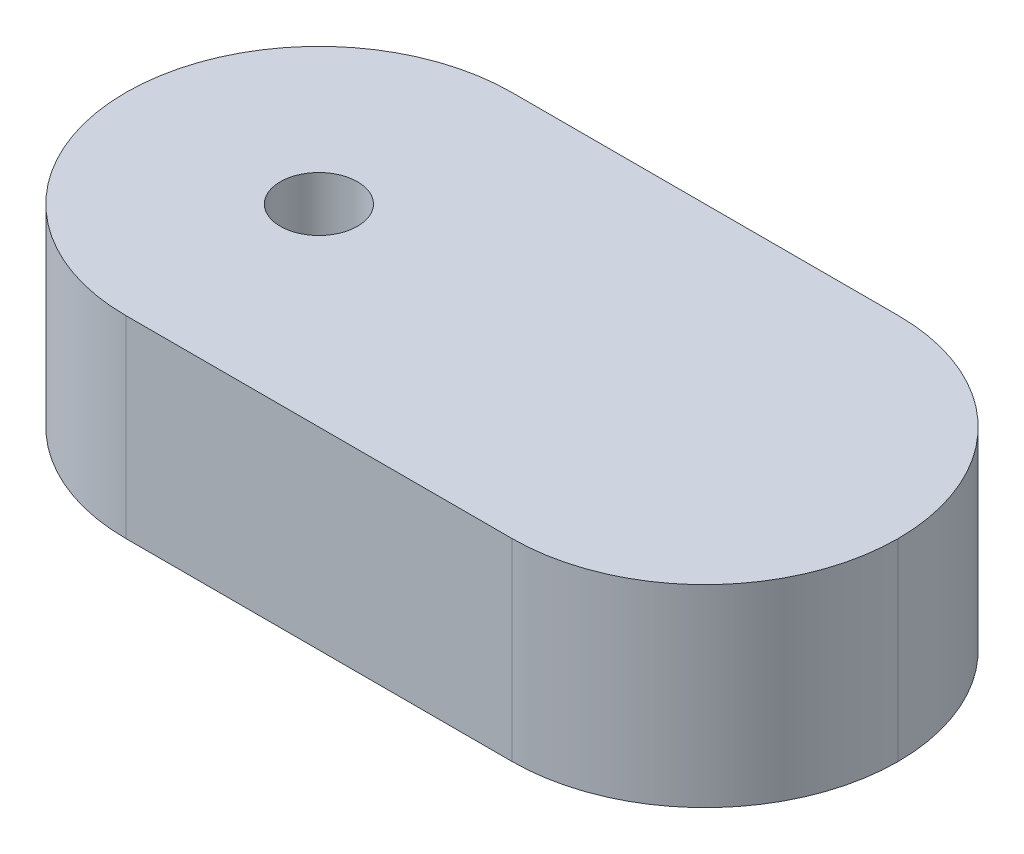
from build123d import *

# Parameters (mm, degrees)
ESBO_O2_W                = 200
ESBO_O2_H                = 100
RESSALTO_EXTRUS_O1_DEPTH = 50
FILETE1_R                = 50
ESBO_O3_R                = 15
CORTE_EXTRUS_O1_DEPTH    = 25
ESBO_O4_R                = 10
CORTE_EXTRUS_O2_DEPTH    = 123.474487139


with BuildPart() as part:
    # Esboço2 → Ressalto-extrusão1 (new body)
    with BuildSketch(Plane(origin=(0, 0, 0), x_dir=(1, 0, 0), z_dir=(0, 1, 0))):
        Rectangle(ESBO_O2_W, ESBO_O2_H)
    extrude(amount=RESSALTO_EXTRUS_O1_DEPTH)

    # Filete1
    filete1_edges = [part.edges().sort_by_distance(p)[0] for p in [
        (100, 25, -50),
        (100, 25, 50),
        (-100, 25, -50),
        (-100, 25, 50),
    ]]
    fillet(filete1_edges, radius=FILETE1_R - 0.0001)  # a hair under: the kernel refuses the full size

    # Esboço3 → Corte-extrusão1 (cut)
    with BuildSketch(Plane.XZ):
        with Locations(Location((50, 0, 0), (0, 0, 270))):
            Circle(ESBO_O3_R)
    extrude(amount=-CORTE_EXTRUS_O1_DEPTH, mode=Mode.SUBTRACT)

    # Esboço4 → Corte-extrusão2 (cut, through all)
    with BuildSketch(Plane.XZ):
        with Locations(Location((-50, 0, 0), (0, 0, 270))):
            Circle(ESBO_O4_R)
    extrude(amount=-CORTE_EXTRUS_O2_DEPTH, mode=Mode.SUBTRACT)


solid = part.part
